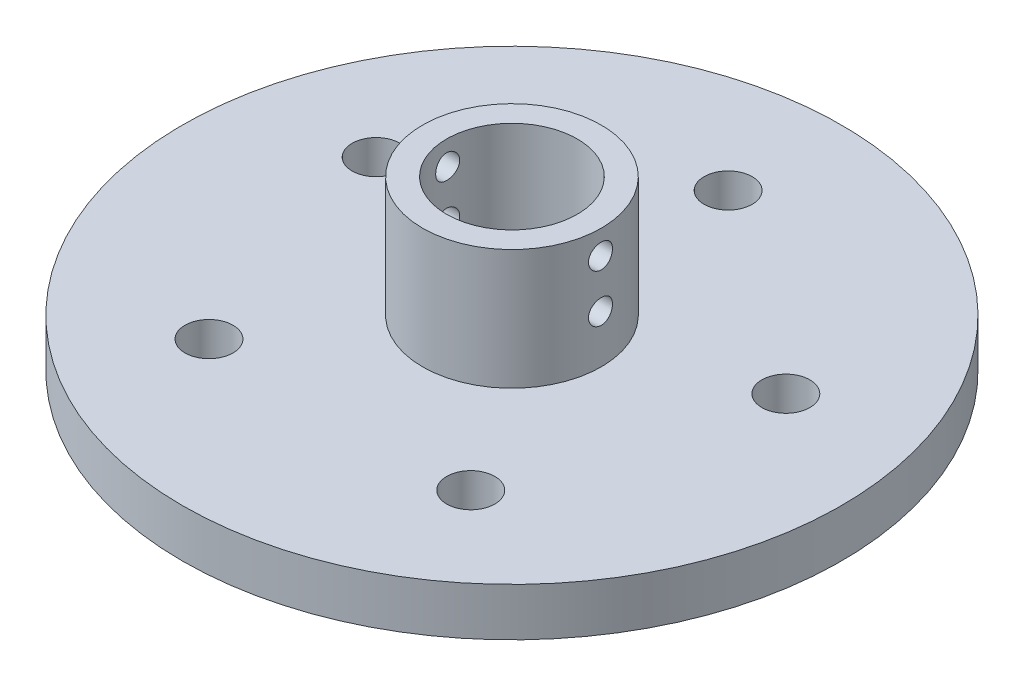
from build123d import *

# Parameters (mm, degrees)
F_1_2_20_TAPPED_HOLE1_D              = 12.7
SKETCH7_W                            = 3.175
SKETCH7_H                            = 87.122
F_1_4_0_25_DIAMETER_HOLE1_AT_2_COUNT = 2
F_1_4_0_25_DIAMETER_HOLE1_AT_2_PITCH = 12.7
F_1_4_0_25_DIAMETER_HOLE2_D          = 6.35


with BuildPart() as part:
    # Sketch1 → Revolve1 (revolve)
    with BuildSketch(Plane.XY):
        Polygon((17.272, 0), (87.122, 0), (87.122, 12.7), (23.622, 12.7), (23.622, 44.45), (17.272, 44.45), align=None)
    revolve(axis=Axis((0, 7.809475806, 0), (0, -1, 0)))

    # 1/2-20 Tapped Hole1 (through all)
    with Locations(Plane(origin=(0, 12.7, 0), x_dir=(1, 0, 0), z_dir=(0, 1, 0))):
        with Locations((-54.155626078, 18.25625), (0, 57.15), (54.155626078, 18.25625), (34.599427772, -45.486284722), (-34.599427772, -45.486284722)):
            Hole(F_1_2_20_TAPPED_HOLE1_D / 2)

    # Sketch7 → 1/4 (0.25) Diameter Hole1 (revolve, cut)
    with BuildSketch(Plane.ZX.offset(38.1)):
        with Locations((1.5875, 43.561)):
            Rectangle(SKETCH7_W, SKETCH7_H)
    f_1_4_0_25_diameter_hole1 = revolve(axis=Axis((-6.35, 38.1, 0), (1, 0, 0)), mode=Mode.SUBTRACT)

    # 1/4 (0.25) Diameter Hole1 at 2: 1/4 (0.25) Diameter Hole1 ×2
    with Locations(*[(0, -i * F_1_4_0_25_DIAMETER_HOLE1_AT_2_PITCH, 0) for i in range(1, F_1_4_0_25_DIAMETER_HOLE1_AT_2_COUNT)]):
        add(f_1_4_0_25_diameter_hole1, mode=Mode.SUBTRACT)

    # 1/4 (0.25) Diameter Hole2 (through all)
    with Locations(Plane(origin=(0, 0, 0), x_dir=(0, 0, -1), z_dir=(1, 0, 0))):
        with Locations((0, 38.1), (0, 25.4)):
            Hole(F_1_4_0_25_DIAMETER_HOLE2_D / 2)


solid = part.part
